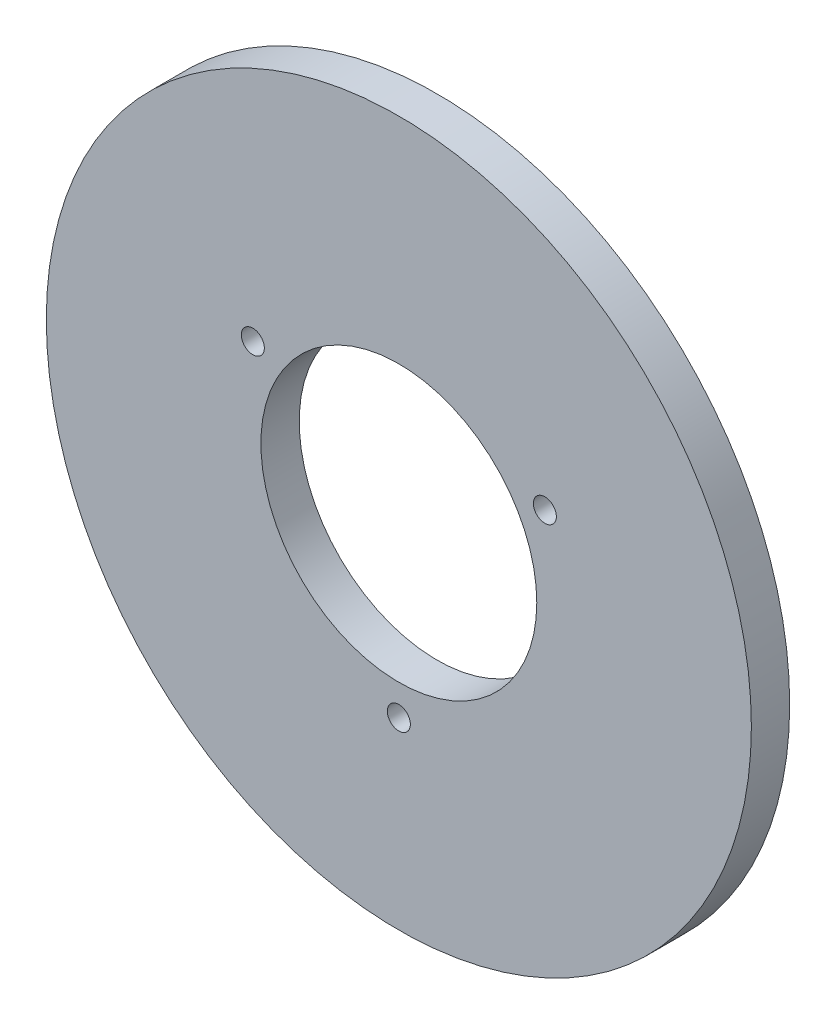
from build123d import *

# Parameters (mm, degrees)
SKETCH2_R           = 46
SKETCH2_R_2         = 18
SKETCH2_R_3         = 1.5
BOSS_EXTRUDE2_DEPTH = 5


with BuildPart() as part:
    # Sketch2 → Boss-Extrude2 (new body)
    with BuildSketch(Plane.XY):
        Circle(SKETCH2_R)
        Circle(SKETCH2_R_2, mode=Mode.SUBTRACT)
        with Locations((0, -22)):
            Circle(SKETCH2_R_3, mode=Mode.SUBTRACT)
        with Locations((-19.052558883, 11)):
            Circle(SKETCH2_R_3, mode=Mode.SUBTRACT)
        with Locations((19.052558883, 11)):
            Circle(SKETCH2_R_3, mode=Mode.SUBTRACT)
    extrude(amount=BOSS_EXTRUDE2_DEPTH)


solid = part.part
